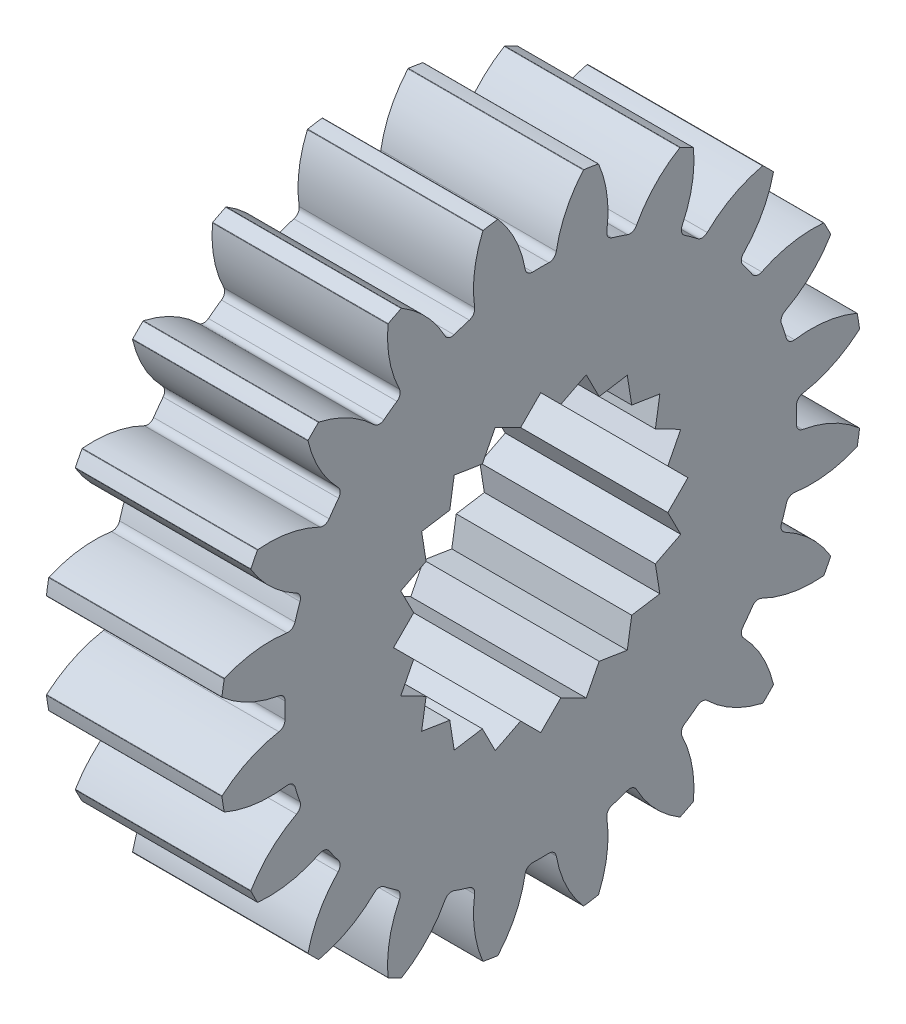
from build123d import *

# Parameters (mm, degrees)
TOOTHCUT_DEPTH     = 9.336666000266531
BREAKS_R           = 0.01
ROOTFILLETS_R      = 0.126
TEETHCUTS_DEPTH    = 3
BORSKE_R           = 1
BORE_DEPTH         = 50.0000508
CUT_EXTRUDE1_DEPTH = 10
CUT_EXTRUDE2_REACH = 10.271


# Read off the part's stored shape, not the designer's step: TeethCuts
with BuildPart() as part:
    # BasProSke → Base-Revolve (revolve)
    with BuildSketch(Plane(origin=(0, 0, 0), x_dir=(1, 0, 0), z_dir=(0, 1, 0)), mode=Mode.PRIVATE) as base_revolve_sk:
        Polygon((0, 0), (0, 5.499999999999998), (2.999999999999999, 5.499999999999999), (2.999999999999999, 0), align=None)
    revolve(base_revolve_sk.sketch.rotate(Axis((-10, 0, 0), (1, 0, 0)), 180), axis=Axis((-10, 0, 0), (1, 0, 0)))

    # TooCutSke → ToothCut (cut, through all)
    with BuildSketch(Plane(origin=(0, 0, 0), x_dir=(0, 0, -1), z_dir=(1, 0, 0))):
        with BuildLine():
            ThreePointArc((0.2499031808687955, 4.366855207147548), (2.7e-16, 4.374), (-0.2499031808687955, 4.366855207147548))
            ThreePointArc((-0.2499031808687955, 4.366855207147548), (-0.41520784394165156, 4.959510309972348), (-0.7528438479538343, 5.473871692010881))
            ThreePointArc((-0.7528438479538343, 5.473871692010881), (3.4e-16, 5.5254), (0.7528438479538343, 5.473871692010881))
            ThreePointArc((0.7528438479538343, 5.473871692010881), (0.41520784394165156, 4.959510309972349), (0.2499031808687955, 4.366855207147548))
        make_face()
    extrude(amount=TOOTHCUT_DEPTH, mode=Mode.SUBTRACT)

    # Breaks
    breaks_edges = [part.edges().sort_by_distance(p)[0] for p in [
        (1.5, 5.451006848352492, -0.732478217569791),
        (1.5, 5.451006848352491, 0.7324782175697916),
    ]]
    fillet(breaks_edges, radius=BREAKS_R)

    # RootFillets
    rootfillets_edges = [part.edges().sort_by_distance(p)[0] for p in [
        (1.5, 4.366855207147549, -0.2499031808687954),
        (1.5, 4.366855207147548, 0.24990318086879532),
    ]]
    fillet(rootfillets_edges, radius=ROOTFILLETS_R)

    # TeethCuts outline → TeethCuts (cut)
    with BuildSketch(Plane.YZ):
        with BuildLine():
            ThreePointArc((4.174867131, 1.636055694), (4.116311817, 1.570158107), (4.115279262, 1.482009649))
            ThreePointArc((4.115279262, 1.482009649), (4.159921202, 1.351640334), (4.200434274, 1.219929468))
            ThreePointArc((4.200434274, 1.219929468), (4.253081993, 1.149222788), (4.339187867, 1.13032847))
            ThreePointArc((4.339187867, 1.13032847), (4.882014052, 1.133174096), (5.40561123, 0.989945746))
            ThreePointArc((5.40561123, 0.989945746), (5.409503739, 0.986985692), (5.411527256, 0.982533847))
            ThreePointArc((5.411527256, 0.982533847), (5.23081084, 1.699593469), (4.95553642, 2.385929334))
            ThreePointArc((4.95553642, 2.385929334), (4.95651609, 2.381138322), (4.95510686, 2.376455628))
            ThreePointArc((4.95510686, 2.376455628), (4.615695357, 1.95281876), (4.174867131, 1.636055694))
        make_face()
        with BuildLine():
            ThreePointArc((4.95510686, -2.376455628), (4.95651609, -2.381138322), (4.95553642, -2.385929334))
            ThreePointArc((4.95553642, -2.385929334), (5.23081084, -1.699593469), (5.411527256, -0.982533847))
            ThreePointArc((5.411527256, -0.982533847), (5.409503739, -0.986985692), (5.40561123, -0.989945746))
            ThreePointArc((5.40561123, -0.989945746), (4.882014052, -1.133174096), (4.339187867, -1.13032847))
            ThreePointArc((4.339187867, -1.13032847), (4.253081993, -1.149222788), (4.200434274, -1.219929468))
            ThreePointArc((4.200434274, -1.219929468), (4.159921202, -1.351640334), (4.115279262, -1.482009649))
            ThreePointArc((4.115279262, -1.482009649), (4.116311817, -1.570158107), (4.174867131, -1.636055694))
            ThreePointArc((4.174867131, -1.636055694), (4.615695357, -1.95281876), (4.95510686, -2.376455628))
        make_face()
        with BuildLine():
            ThreePointArc((3.978221493, -3.79135584), (3.978114719, -3.796244822), (3.975702493, -3.80049861))
            ThreePointArc((3.975702493, -3.80049861), (4.449593469, -3.232818888), (4.843048603, -2.606699105))
            ThreePointArc((4.843048603, -2.606699105), (4.839748429, -2.610307761), (4.835131726, -2.611920088))
            ThreePointArc((4.835131726, -2.611920088), (4.292901224, -2.586337917), (3.77752219, -2.415889049))
            ThreePointArc((3.77752219, -2.415889049), (3.689791972, -2.407250436), (3.617871451, -2.458227444))
            ThreePointArc((3.617871451, -2.458227444), (3.538640333, -2.570972693), (3.455896991, -2.681166162))
            ThreePointArc((3.455896991, -2.681166162), (3.429639638, -2.765319404), (3.464965576, -2.846086321))
            ThreePointArc((3.464965576, -2.846086321), (3.786332963, -3.283569313), (3.978221493, -3.79135584))
        make_face()
        with BuildLine():
            ThreePointArc((2.611920088, -4.835131726), (2.610307761, -4.839748429), (2.606699105, -4.843048603))
            ThreePointArc((2.606699105, -4.843048603), (3.232818888, -4.449593469), (3.80049861, -3.975702493))
            ThreePointArc((3.80049861, -3.975702493), (3.796244822, -3.978114719), (3.79135584, -3.978221493))
            ThreePointArc((3.79135584, -3.978221493), (3.283569313, -3.786332963), (2.846086321, -3.464965576))
            ThreePointArc((2.846086321, -3.464965576), (2.765319404, -3.429639638), (2.681166162, -3.455896991))
            ThreePointArc((2.681166162, -3.455896991), (2.570972693, -3.538640333), (2.458227444, -3.617871451))
            ThreePointArc((2.458227444, -3.617871451), (2.407250436, -3.689791972), (2.415889049, -3.77752219))
            ThreePointArc((2.415889049, -3.77752219), (2.586337917, -4.292901224), (2.611920088, -4.835131726))
        make_face()
        with BuildLine():
            ThreePointArc((0.989945746, -5.40561123), (0.986985692, -5.409503739), (0.982533847, -5.411527256))
            ThreePointArc((0.982533847, -5.411527256), (1.699593469, -5.23081084), (2.385929334, -4.95553642))
            ThreePointArc((2.385929334, -4.95553642), (2.381138322, -4.95651609), (2.376455628, -4.95510686))
            ThreePointArc((2.376455628, -4.95510686), (1.95281876, -4.615695357), (1.636055694, -4.174867131))
            ThreePointArc((1.636055694, -4.174867131), (1.570158107, -4.116311817), (1.482009649, -4.115279262))
            ThreePointArc((1.482009649, -4.115279262), (1.351640334, -4.159921202), (1.219929468, -4.200434274))
            ThreePointArc((1.219929468, -4.200434274), (1.149222788, -4.253081993), (1.13032847, -4.339187867))
            ThreePointArc((1.13032847, -4.339187867), (1.133174096, -4.882014052), (0.989945746, -5.40561123))
        make_face()
        with BuildLine():
            ThreePointArc((-0.728931382, -5.446951844), (-0.732949412, -5.449739133), (-0.73780867, -5.450287916))
            ThreePointArc((-0.73780867, -5.450287916), (0, -5.5), (0.73780867, -5.450287916))
            ThreePointArc((0.73780867, -5.450287916), (0.732949412, -5.449739133), (0.728931382, -5.446951844))
            ThreePointArc((0.728931382, -5.446951844), (0.430912701, -4.99324133), (0.265876536, -4.476103602))
            ThreePointArc((0.265876536, -4.476103602), (0.221298793, -4.400050716), (0.137783705, -4.371829325))
            ThreePointArc((0.137783705, -4.371829325), (0, -4.374), (-0.137783705, -4.371829325))
            ThreePointArc((-0.137783705, -4.371829325), (-0.221298793, -4.400050716), (-0.265876536, -4.476103602))
            ThreePointArc((-0.265876536, -4.476103602), (-0.430912701, -4.99324133), (-0.728931382, -5.446951844))
        make_face()
        with BuildLine():
            ThreePointArc((-2.376455628, -4.95510686), (-2.381138322, -4.95651609), (-2.385929334, -4.95553642))
            ThreePointArc((-2.385929334, -4.95553642), (-1.699593469, -5.23081084), (-0.982533847, -5.411527256))
            ThreePointArc((-0.982533847, -5.411527256), (-0.986985692, -5.409503739), (-0.989945746, -5.40561123))
            ThreePointArc((-0.989945746, -5.40561123), (-1.133174096, -4.882014052), (-1.13032847, -4.339187867))
            ThreePointArc((-1.13032847, -4.339187867), (-1.149222788, -4.253081993), (-1.219929468, -4.200434274))
            ThreePointArc((-1.219929468, -4.200434274), (-1.351640334, -4.159921202), (-1.482009649, -4.115279262))
            ThreePointArc((-1.482009649, -4.115279262), (-1.570158107, -4.116311817), (-1.636055694, -4.174867131))
            ThreePointArc((-1.636055694, -4.174867131), (-1.95281876, -4.615695357), (-2.376455628, -4.95510686))
        make_face()
        with BuildLine():
            ThreePointArc((-3.79135584, -3.978221493), (-3.796244822, -3.978114719), (-3.80049861, -3.975702493))
            ThreePointArc((-3.80049861, -3.975702493), (-3.232818888, -4.449593469), (-2.606699105, -4.843048603))
            ThreePointArc((-2.606699105, -4.843048603), (-2.610307761, -4.839748429), (-2.611920088, -4.835131726))
            ThreePointArc((-2.611920088, -4.835131726), (-2.586337917, -4.292901224), (-2.415889049, -3.77752219))
            ThreePointArc((-2.415889049, -3.77752219), (-2.407250436, -3.689791972), (-2.458227444, -3.617871451))
            ThreePointArc((-2.458227444, -3.617871451), (-2.570972693, -3.538640333), (-2.681166162, -3.455896991))
            ThreePointArc((-2.681166162, -3.455896991), (-2.765319404, -3.429639638), (-2.846086321, -3.464965576))
            ThreePointArc((-2.846086321, -3.464965576), (-3.283569313, -3.786332963), (-3.79135584, -3.978221493))
        make_face()
        with BuildLine():
            ThreePointArc((-4.835131726, -2.611920088), (-4.839748429, -2.610307761), (-4.843048603, -2.606699105))
            ThreePointArc((-4.843048603, -2.606699105), (-4.449593469, -3.232818888), (-3.975702493, -3.80049861))
            ThreePointArc((-3.975702493, -3.80049861), (-3.978114719, -3.796244822), (-3.978221493, -3.79135584))
            ThreePointArc((-3.978221493, -3.79135584), (-3.786332963, -3.283569313), (-3.464965576, -2.846086321))
            ThreePointArc((-3.464965576, -2.846086321), (-3.429639638, -2.765319404), (-3.455896991, -2.681166162))
            ThreePointArc((-3.455896991, -2.681166162), (-3.538640333, -2.570972693), (-3.617871451, -2.458227444))
            ThreePointArc((-3.617871451, -2.458227444), (-3.689791972, -2.407250436), (-3.77752219, -2.415889049))
            ThreePointArc((-3.77752219, -2.415889049), (-4.292901224, -2.586337917), (-4.835131726, -2.611920088))
        make_face()
        with BuildLine():
            ThreePointArc((-5.40561123, -0.989945746), (-5.409503739, -0.986985692), (-5.411527256, -0.982533847))
            ThreePointArc((-5.411527256, -0.982533847), (-5.23081084, -1.699593469), (-4.95553642, -2.385929334))
            ThreePointArc((-4.95553642, -2.385929334), (-4.95651609, -2.381138322), (-4.95510686, -2.376455628))
            ThreePointArc((-4.95510686, -2.376455628), (-4.615695357, -1.95281876), (-4.174867131, -1.636055694))
            ThreePointArc((-4.174867131, -1.636055694), (-4.116311817, -1.570158107), (-4.115279262, -1.482009649))
            ThreePointArc((-4.115279262, -1.482009649), (-4.159921202, -1.351640334), (-4.200434274, -1.219929468))
            ThreePointArc((-4.200434274, -1.219929468), (-4.253081993, -1.149222788), (-4.339187867, -1.13032847))
            ThreePointArc((-4.339187867, -1.13032847), (-4.882014052, -1.133174096), (-5.40561123, -0.989945746))
        make_face()
        with BuildLine():
            ThreePointArc((-5.446951844, 0.728931382), (-5.449739133, 0.732949412), (-5.450287916, 0.73780867))
            ThreePointArc((-5.450287916, 0.73780867), (-5.5, 0), (-5.450287916, -0.73780867))
            ThreePointArc((-5.450287916, -0.73780867), (-5.449739133, -0.732949412), (-5.446951844, -0.728931382))
            ThreePointArc((-5.446951844, -0.728931382), (-4.99324133, -0.430912701), (-4.476103602, -0.265876536))
            ThreePointArc((-4.476103602, -0.265876536), (-4.400050716, -0.221298793), (-4.371829325, -0.137783705))
            ThreePointArc((-4.371829325, -0.137783705), (-4.374, 0), (-4.371829325, 0.137783705))
            ThreePointArc((-4.371829325, 0.137783705), (-4.400050716, 0.221298793), (-4.476103602, 0.265876536))
            ThreePointArc((-4.476103602, 0.265876536), (-4.99324133, 0.430912701), (-5.446951844, 0.728931382))
        make_face()
        with BuildLine():
            ThreePointArc((-4.95510686, 2.376455628), (-4.95651609, 2.381138322), (-4.95553642, 2.385929334))
            ThreePointArc((-4.95553642, 2.385929334), (-5.23081084, 1.699593469), (-5.411527256, 0.982533847))
            ThreePointArc((-5.411527256, 0.982533847), (-5.409503739, 0.986985692), (-5.40561123, 0.989945746))
            ThreePointArc((-5.40561123, 0.989945746), (-4.882014052, 1.133174096), (-4.339187867, 1.13032847))
            ThreePointArc((-4.339187867, 1.13032847), (-4.253081993, 1.149222788), (-4.200434274, 1.219929468))
            ThreePointArc((-4.200434274, 1.219929468), (-4.159921202, 1.351640334), (-4.115279262, 1.482009649))
            ThreePointArc((-4.115279262, 1.482009649), (-4.116311817, 1.570158107), (-4.174867131, 1.636055694))
            ThreePointArc((-4.174867131, 1.636055694), (-4.615695357, 1.95281876), (-4.95510686, 2.376455628))
        make_face()
        with BuildLine():
            ThreePointArc((-3.978221493, 3.79135584), (-3.978114719, 3.796244822), (-3.975702493, 3.80049861))
            ThreePointArc((-3.975702493, 3.80049861), (-4.449593469, 3.232818888), (-4.843048603, 2.606699105))
            ThreePointArc((-4.843048603, 2.606699105), (-4.839748429, 2.610307761), (-4.835131726, 2.611920088))
            ThreePointArc((-4.835131726, 2.611920088), (-4.292901224, 2.586337917), (-3.77752219, 2.415889049))
            ThreePointArc((-3.77752219, 2.415889049), (-3.689791972, 2.407250436), (-3.617871451, 2.458227444))
            ThreePointArc((-3.617871451, 2.458227444), (-3.538640333, 2.570972693), (-3.455896991, 2.681166162))
            ThreePointArc((-3.455896991, 2.681166162), (-3.429639638, 2.765319404), (-3.464965576, 2.846086321))
            ThreePointArc((-3.464965576, 2.846086321), (-3.786332963, 3.283569313), (-3.978221493, 3.79135584))
        make_face()
        with BuildLine():
            ThreePointArc((-2.611920088, 4.835131726), (-2.610307761, 4.839748429), (-2.606699105, 4.843048603))
            ThreePointArc((-2.606699105, 4.843048603), (-3.232818888, 4.449593469), (-3.80049861, 3.975702493))
            ThreePointArc((-3.80049861, 3.975702493), (-3.796244822, 3.978114719), (-3.79135584, 3.978221493))
            ThreePointArc((-3.79135584, 3.978221493), (-3.283569313, 3.786332963), (-2.846086321, 3.464965576))
            ThreePointArc((-2.846086321, 3.464965576), (-2.765319404, 3.429639638), (-2.681166162, 3.455896991))
            ThreePointArc((-2.681166162, 3.455896991), (-2.570972693, 3.538640333), (-2.458227444, 3.617871451))
            ThreePointArc((-2.458227444, 3.617871451), (-2.407250436, 3.689791972), (-2.415889049, 3.77752219))
            ThreePointArc((-2.415889049, 3.77752219), (-2.586337917, 4.292901224), (-2.611920088, 4.835131726))
        make_face()
        with BuildLine():
            ThreePointArc((-0.989945746, 5.40561123), (-0.986985692, 5.409503739), (-0.982533847, 5.411527256))
            ThreePointArc((-0.982533847, 5.411527256), (-1.699593469, 5.23081084), (-2.385929334, 4.95553642))
            ThreePointArc((-2.385929334, 4.95553642), (-2.381138322, 4.95651609), (-2.376455628, 4.95510686))
            ThreePointArc((-2.376455628, 4.95510686), (-1.95281876, 4.615695357), (-1.636055694, 4.174867131))
            ThreePointArc((-1.636055694, 4.174867131), (-1.570158107, 4.116311817), (-1.482009649, 4.115279262))
            ThreePointArc((-1.482009649, 4.115279262), (-1.351640334, 4.159921202), (-1.219929468, 4.200434274))
            ThreePointArc((-1.219929468, 4.200434274), (-1.149222788, 4.253081993), (-1.13032847, 4.339187867))
            ThreePointArc((-1.13032847, 4.339187867), (-1.133174096, 4.882014052), (-0.989945746, 5.40561123))
        make_face()
        with BuildLine():
            ThreePointArc((0.728931382, 5.446951844), (0.732949412, 5.449739133), (0.73780867, 5.450287916))
            ThreePointArc((0.73780867, 5.450287916), (0, 5.5), (-0.73780867, 5.450287916))
            ThreePointArc((-0.73780867, 5.450287916), (-0.732949412, 5.449739133), (-0.728931382, 5.446951844))
            ThreePointArc((-0.728931382, 5.446951844), (-0.430912701, 4.99324133), (-0.265876536, 4.476103602))
            ThreePointArc((-0.265876536, 4.476103602), (-0.221298793, 4.400050716), (-0.137783705, 4.371829325))
            ThreePointArc((-0.137783705, 4.371829325), (0, 4.374), (0.137783705, 4.371829325))
            ThreePointArc((0.137783705, 4.371829325), (0.221298793, 4.400050716), (0.265876536, 4.476103602))
            ThreePointArc((0.265876536, 4.476103602), (0.430912701, 4.99324133), (0.728931382, 5.446951844))
        make_face()
        with BuildLine():
            ThreePointArc((2.376455628, 4.95510686), (2.381138322, 4.95651609), (2.385929334, 4.95553642))
            ThreePointArc((2.385929334, 4.95553642), (1.699593469, 5.23081084), (0.982533847, 5.411527256))
            ThreePointArc((0.982533847, 5.411527256), (0.986985692, 5.409503739), (0.989945746, 5.40561123))
            ThreePointArc((0.989945746, 5.40561123), (1.133174096, 4.882014052), (1.13032847, 4.339187867))
            ThreePointArc((1.13032847, 4.339187867), (1.149222788, 4.253081993), (1.219929468, 4.200434274))
            ThreePointArc((1.219929468, 4.200434274), (1.351640334, 4.159921202), (1.482009649, 4.115279262))
            ThreePointArc((1.482009649, 4.115279262), (1.570158107, 4.116311817), (1.636055694, 4.174867131))
            ThreePointArc((1.636055694, 4.174867131), (1.95281876, 4.615695357), (2.376455628, 4.95510686))
        make_face()
        with BuildLine():
            ThreePointArc((3.79135584, 3.978221493), (3.796244822, 3.978114719), (3.80049861, 3.975702493))
            ThreePointArc((3.80049861, 3.975702493), (3.232818888, 4.449593469), (2.606699105, 4.843048603))
            ThreePointArc((2.606699105, 4.843048603), (2.610307761, 4.839748429), (2.611920088, 4.835131726))
            ThreePointArc((2.611920088, 4.835131726), (2.586337917, 4.292901224), (2.415889049, 3.77752219))
            ThreePointArc((2.415889049, 3.77752219), (2.407250436, 3.689791972), (2.458227444, 3.617871451))
            ThreePointArc((2.458227444, 3.617871451), (2.570972693, 3.538640333), (2.681166162, 3.455896991))
            ThreePointArc((2.681166162, 3.455896991), (2.765319404, 3.429639638), (2.846086321, 3.464965576))
            ThreePointArc((2.846086321, 3.464965576), (3.283569313, 3.786332963), (3.79135584, 3.978221493))
        make_face()
        with BuildLine():
            ThreePointArc((4.835131726, 2.611920088), (4.839748429, 2.610307761), (4.843048603, 2.606699105))
            ThreePointArc((4.843048603, 2.606699105), (4.449593469, 3.232818888), (3.975702493, 3.80049861))
            ThreePointArc((3.975702493, 3.80049861), (3.978114719, 3.796244822), (3.978221493, 3.79135584))
            ThreePointArc((3.978221493, 3.79135584), (3.786332963, 3.283569313), (3.464965576, 2.846086321))
            ThreePointArc((3.464965576, 2.846086321), (3.429639638, 2.765319404), (3.455896991, 2.681166162))
            ThreePointArc((3.455896991, 2.681166162), (3.538640333, 2.570972693), (3.617871451, 2.458227444))
            ThreePointArc((3.617871451, 2.458227444), (3.689791972, 2.407250436), (3.77752219, 2.415889049))
            ThreePointArc((3.77752219, 2.415889049), (4.292901224, 2.586337917), (4.835131726, 2.611920088))
        make_face()
    extrude(amount=TEETHCUTS_DEPTH, mode=Mode.SUBTRACT)

    # BorSke → Bore (cut, symmetric)
    with BuildSketch(Plane(origin=(0, 0, 0), x_dir=(0, 0, -1), z_dir=(1, 0, 0))):
        with Locations(Location((0, 0, 0), (0, 0, 180))):
            Circle(BORSKE_R)
    extrude(amount=BORE_DEPTH, both=True, mode=Mode.SUBTRACT)

    # Sketch1 → Cut-Extrude1 (cut)
    with BuildSketch(Plane.ZY):
        Polygon((-0.324730747993643, 2.050269252006364), (-5.25e-15, 2.375), (0.32473074799362445, 2.050269252006366), (0.7339153616404951, 2.2587592262009917), (0.9424053358351153, 1.8495746125541273), (1.3959899741946193, 1.9214153616405034), (1.467830723280993, 1.4678307232810064), (1.921415361640497, 1.395989974194628), (1.8495746125541186, 0.9424053358351321), (2.258759226200988, 0.7339153616405053), (2.050269252006364, 0.3247307479936432), (2.375, 5.42e-15), (2.0502692520063666, -0.32473074799362434), (2.2587592262009917, -0.7339153616404949), (1.8495746125541275, -0.9424053358351151), (1.9214153616405036, -1.3959899741946193), (1.4678307232810066, -1.4678307232809928), (1.3959899741946282, -1.9214153616404968), (0.942405335835132, -1.8495746125541181), (0.7339153616405053, -2.258759226200988), (0.32473074799364327, -2.0502692520063635), (5.54e-15, -2.375), (-0.3247307479936242, -2.0502692520063666), (-0.7339153616404948, -2.2587592262009917), (-0.9424053358351151, -1.8495746125541275), (-1.3959899741946193, -1.9214153616405036), (-1.4678307232809928, -1.4678307232810066), (-1.9214153616404968, -1.3959899741946282), (-1.8495746125541181, -0.9424053358351322), (-2.258759226200988, -0.7339153616405054), (-2.0502692520063635, -0.3247307479936435), (-2.3750000000000004, -5.75e-15), (-2.0502692520063666, 0.3247307479936241), (-2.2587592262009917, 0.7339153616404946), (-1.8495746125541275, 0.9424053358351147), (-1.9214153616405036, 1.395989974194619), (-1.4678307232810068, 1.4678307232809928), (-1.3959899741946284, 1.9214153616404968), (-0.9424053358351323, 1.8495746125541181), (-0.7339153616405057, 2.258759226200988), align=None)
    extrude(amount=-CUT_EXTRUDE1_DEPTH, mode=Mode.SUBTRACT)

    # Sketch2 → Cut-Extrude2 (cut, up to next)
    with BuildSketch(Plane.ZY, mode=Mode.PRIVATE) as cut_extrude2_sk1:
        Polygon((-2.0358276422040404, 1.47911536175011), (-1.9597090757833904, 0.9985216477168334), (-2.3932589285937826, 0.7776169640853774), (-2.1723542449623223, 0.34406711127497874), (-2.51642135623731, -5.16e-15), (-2.172354244962319, -0.3440671112749972), (-2.3932589285937795, -0.7776169640853872), (-1.9597090757833817, -0.9985216477168498), (-2.035827642204034, -1.4791153617501187), (-1.5552339281707575, -1.5552339281707703), (-1.4791153617501105, -2.0358276422040404), (-0.9985216477168336, -1.9597090757833904), (-0.7776169640853774, -2.3932589285937826), (-0.3440671112749788, -2.1723542449623223), (4.99e-15, -2.5164213562373097), (0.34406711127499684, -2.172354244962319), (0.777616964085387, -2.3932589285937795), (0.9985216477168496, -1.9597090757833817), (1.4791153617501187, -2.035827642204034), (1.5552339281707703, -1.5552339281707575), (2.0358276422040404, -1.4791153617501105), (1.9597090757833904, -0.9985216477168337), (2.3932589285937826, -0.7776169640853777), (2.1723542449623223, -0.3440671112749789), (2.5164213562373097, 4.8e-15), (2.17235424496232, 0.3440671112749965), (2.39325892859378, 0.7776169640853869), (1.9597090757833822, 0.9985216477168498), (2.0358276422040342, 1.4791153617501185), (1.5552339281707577, 1.5552339281707703), (1.4791153617501105, 2.0358276422040404), (0.9985216477168339, 1.9597090757833904), (0.777616964085378, 2.393258928593783), (0.3440671112749791, 2.172354244962322), (-4.5e-15, 2.5164213562373097), (-0.3440671112749964, 2.17235424496232), (-0.7776169640853874, 2.3932589285937795), (-0.99852164771685, 1.9597090757833817), (-1.479115361750119, 2.035827642204034), (-1.5552339281707708, 1.5552339281707575), align=None)
    cut_extrude2_tool1 = extrude(cut_extrude2_sk1.sketch, amount=-CUT_EXTRUDE2_REACH, mode=Mode.PRIVATE) & part.part
    add(cut_extrude2_tool1.solids().sort_by_distance((0, 0, 0))[0], mode=Mode.SUBTRACT)


solid = part.part
